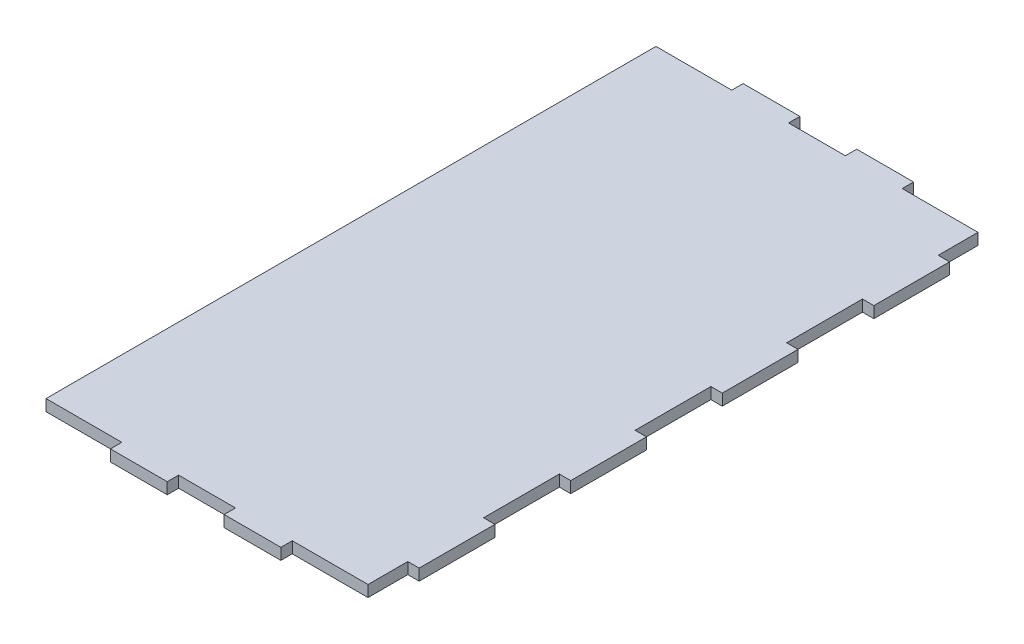
from build123d import *

# Parameters (mm, degrees)
SALIENTE_EXTRUIR1_DEPTH = 3


with BuildPart() as part:
    # Croquis1 → Saliente-Extruir1 (new body)
    with BuildSketch(Plane(origin=(0, 0, 0), x_dir=(1, 0, 0), z_dir=(0, 1, 0))):
        Polygon((25.5, 2.5), (25.5, -0.5), (40.5, -0.5), (40.5, 2.5), (55.5, 2.5), (55.5, -0.5), (70.5, -0.5), (70.5, 2.5), (90.5, 2.5), (90.5, 13), (93.5, 13), (93.5, 33), (90.5, 33), (90.5, 53), (93.5, 53), (93.5, 73), (90.5, 73), (90.5, 93), (93.5, 93), (93.5, 113), (90.5, 113), (90.5, 133), (93.5, 133), (93.5, 153), (90.5, 153), (90.5, 163.5), (70.5, 163.5), (70.5, 166.5), (55.5, 166.5), (55.5, 163.5), (40.5, 163.5), (40.5, 166.5), (25.5, 166.5), (25.5, 163.5), (5.5, 163.5), (5.5, 153), (5.5, 133), (5.5, 113), (5.5, 93), (5.5, 73), (5.5, 53), (5.5, 33), (5.5, 13), (5.5, 2.5), align=None)
    extrude(amount=SALIENTE_EXTRUIR1_DEPTH)


solid = part.part
